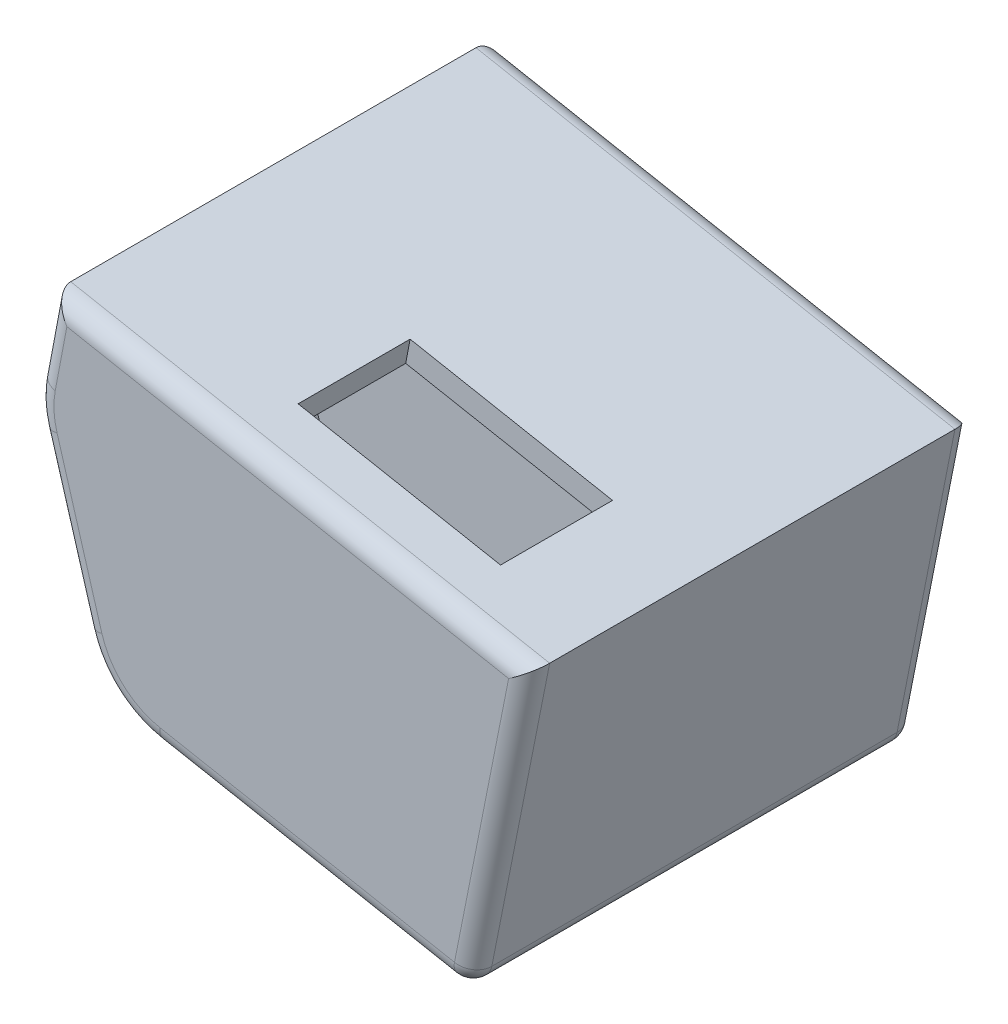
from build123d import *

# Parameters (mm, degrees)
EXTRUDE_3_DEPTH     = 21
EXTRUDE_1_DEPTH     = 2.5
SKETCH_9_R          = 1.25
EXTRUDE_2_DEPTH     = 2.5
EXTRUDE_3_2_DEPTH   = 2.5
SKETCH_11_W         = 42
SKETCH_11_H         = 10.406253358
CUT_EXTRUDE_1_DEPTH = 5
FILLET_1_R          = 10
FILLET_2_R          = 2
SKETCH_12_W         = 21.859303669
SKETCH_12_H         = 11.880056341
CUT_EXTRUDE_2_DEPTH = 61
SKETCH_14_R         = 2
CUT_EXTRUDE_3_DEPTH = 10


with BuildPart() as part:
    # 草图7 → Extrude 3 (new, symmetric)
    with BuildSketch(Plane.XY):
        Polygon((51.618317891, 4.889024384), (54.886055332, 4.268404852), (61.410827986, 37.137721863), (10.591755085, 46.789448736), (8.530755399, 35.937702238), (15.711697443, 11.708528829), (19.787318129, 10.93447343), (20.253787963, 13.390569091), (17.675542885, 13.880237947), (11.09997038, 36.066837632), (12.581380912, 43.866883241), (58.467863291, 35.15197032), (52.916660674, 7.187127975), (52.084787725, 7.345120045), align=None)
    extrude(amount=EXTRUDE_3_DEPTH, both=True)

    # 草图8 → 凸台-拉伸1 (add)
    with BuildSketch(Plane.XY.offset(21)):
        Polygon((58.467863291, 35.15197032), (52.916660674, 7.187127975), (52.084787725, 7.345120045), (51.618317891, 4.889024384), (54.886055332, 4.268404852), (61.410827986, 37.137721863), (10.591755085, 46.789448736), (8.530755399, 35.937702238), (15.711697443, 11.708528829), (19.787318129, 10.93447343), (20.253787963, 13.390569091), (17.675542885, 13.880237947), (11.09997038, 36.066837632), (12.581380912, 43.866883241), align=None)
        Polygon((19.787318129, 10.93447343), (51.618317891, 4.889024384), (52.084787725, 7.345120045), (52.916660674, 7.187127975), (58.467863291, 35.15197032), (12.581380912, 43.866883241), (11.09997038, 36.066837632), (17.675542885, 13.880237947), (20.253787963, 13.390569091), align=None)
    extrude(amount=EXTRUDE_1_DEPTH)

    # 草图9 → 凸台-拉伸2 (add)
    with BuildSketch(Plane.XY.offset(-3.5)):
        Polygon((24.397237371, 10.058942279), (26.710927747, 22.241176755), (49.405425881, 17.930962401), (47.091735505, 5.748727924), (54.886055332, 4.268404852), (61.410827986, 37.137721863), (10.591755085, 46.789448736), (8.530755399, 35.937702238), (15.711697443, 11.708528829), align=None)
        with Locations((23.400258978, 16.559120835)):
            Circle(SKETCH_9_R, mode=Mode.SUBTRACT)
        with Locations((50.319067418, 11.446611456)):
            Circle(SKETCH_9_R, mode=Mode.SUBTRACT)
    extrude(amount=EXTRUDE_2_DEPTH)

    # 草图10 → Extrude 3 2 (add)
    with BuildSketch(Plane(origin=(0, 0, -21), x_dir=(-1, 0, 0), z_dir=(0, 0, -1))):
        Polygon((-15.711697443, 11.708528829), (-8.530755399, 35.937702238), (-10.591755085, 46.789448736), (-61.410827986, 37.137721863), (-54.886055332, 4.268404852), align=None)
    extrude(amount=EXTRUDE_3_2_DEPTH)

    # 草图11 → 切除-拉伸1 (cut)
    with BuildSketch(Plane(origin=(17.63296674, 5.225985637, 0), x_dir=(0, 0, 1), z_dir=(-0.9587773323568242, -0.28415845396315786, 0))):
        with Locations((0, 7.59472781)):
            Rectangle(SKETCH_11_W, SKETCH_11_H)
    extrude(amount=-CUT_EXTRUDE_1_DEPTH, mode=Mode.SUBTRACT)

    # 圆角1
    # the kernel refuses this fillet: 10 mm, written as the material it takes off along each edge
    with BuildSketch(Plane(origin=(15.711697443, 11.708528829, -5.758578091), x_dir=(0.9824382642502659, -0.18658793352445072, 0), z_dir=(0, 0, -1)), Plane(origin=(15.711697443, 11.708528829, 38.741421909), x_dir=(0.9824382642502659, -0.18658793352445072, 0), z_dir=(0, 0, -1))) as fillet_1_piece_1:
        with BuildLine():
            CenterArc((FILLET_1_R * 0.609656876359, -FILLET_1_R), FILLET_1_R, 90, 62.737721614)
            Line((-FILLET_1_R * 0.279262123126, -FILLET_1_R * 0.541935580562), (0, 0))
            Line((0, 0), (FILLET_1_R * 0.609656876359, 0))
        make_face()
    extrude(amount=32.982843818, mode=Mode.SUBTRACT)
    with BuildSketch(Plane(origin=(21.237725488, 10.659007254, -17.317640641), x_dir=(0.9824382642502885, -0.18658793352433115, 0), z_dir=(0, 0, 1))) as fillet_1_piece_2:
        with BuildLine():
            CenterArc((6.357442179, 9.493749512), FILLET_1_R, 207.262278386, 44.428504043)
            Line((-2.531747815, 4.913105318), (0, 0))
            Line((0, 0), (3.215990254, 0))
        make_face()
    extrude(amount=30.135281283, mode=Mode.SUBTRACT)
    with BuildSketch(Plane(origin=(8.530755399, 35.937702238, 29.562520674), x_dir=(0.18658793352445296, 0.9824382642502654, 0), z_dir=(0, 0, -1))) as fillet_1_piece_3:
        with BuildLine():
            CenterArc((FILLET_1_R * 0.242500826961, FILLET_1_R), FILLET_1_R, 242.737721614, 27.262278386)
            Line((-FILLET_1_R * 0.215563592477, FILLET_1_R * 0.111081000515), (0, 0))
            Line((0, 0), (FILLET_1_R * 0.242500826961, 0))
        make_face()
    extrude(amount=59.125041348, mode=Mode.SUBTRACT)

    # 圆角2
    fillet_2_edges = [part.edges().sort_by_distance(p)[0] for p in [
        (36.001291535, 41.963585299, -23.5),
        (58.148441659, 20.703063357, -23.5),
        (38.293627604, 7.419693757, -23.5),
        (11.599573944, 25.583220021, 23.5),
        (11.599573944, 25.583220021, -23.5),
        (9.787493883, 42.554785944, -23.5),
        (16.859888508, 12.978250443, -23.5),
        (8.820223079, 35.952251632, -23.5),
        (38.293627604, 7.419693757, 23.5),
        (16.859888508, 12.978250443, 23.5),
        (8.820223079, 35.952251632, 23.5),
        (54.886055332, 4.268404852, 0),
        (58.148441659, 20.703063357, 23.5),
        (36.001291535, 41.963585299, 23.5),
        (9.787493883, 42.554785944, 23.5),
    ]]
    fillet(fillet_2_edges, radius=FILLET_2_R)

    # 草图12 → 切除-拉伸2 (cut)
    with BuildSketch(Plane(origin=(8.479309234, 44.645962299, 0), x_dir=(0.9824382642502656, -0.18658793352445194, 0), z_dir=(-0.18658793352445194, -0.9824382642502656, 0))):
        with Locations((32.525954901, 11.00026169)):
            Rectangle(SKETCH_12_W, SKETCH_12_H)
    extrude(amount=-CUT_EXTRUDE_2_DEPTH, mode=Mode.SUBTRACT)

    # 草图14 → 切除-拉伸3 (cut)
    with BuildSketch(Plane(origin=(0, 0, -23.5), x_dir=(-1, 0, 0), z_dir=(0, 0, -1))):
        with Locations((-50.319067418, 11.446611456)):
            Circle(SKETCH_14_R)
        with Locations((-23.400258978, 16.559120835)):
            Circle(SKETCH_14_R)
    extrude(amount=-CUT_EXTRUDE_3_DEPTH, mode=Mode.SUBTRACT)


solid = part.part
